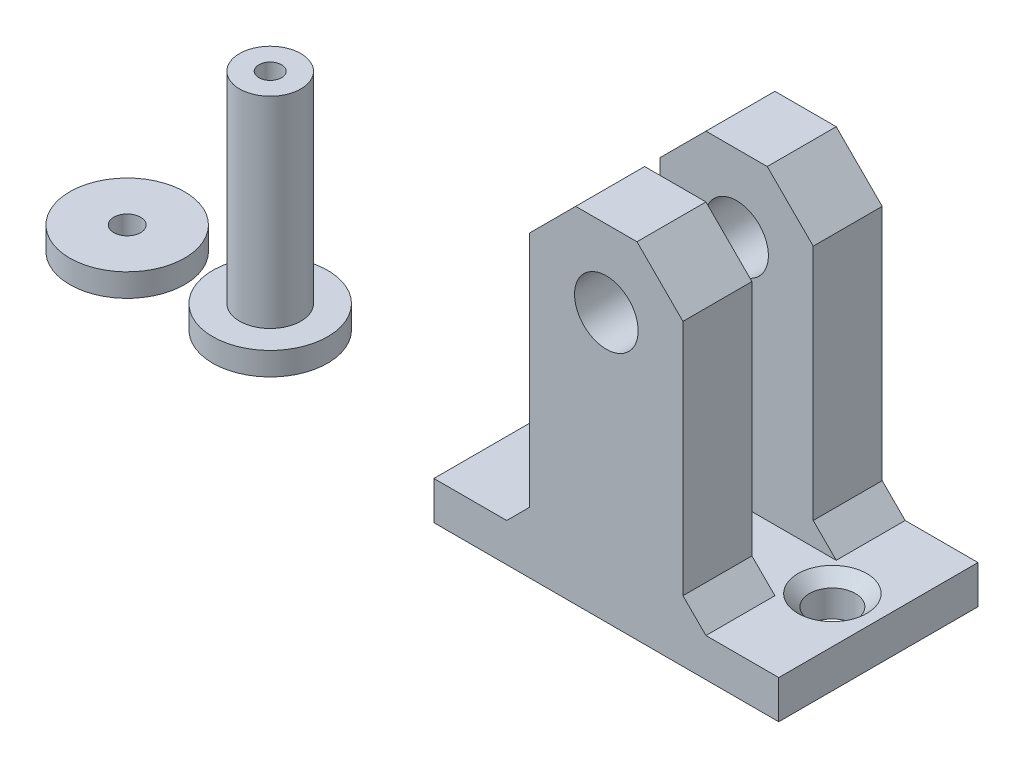
from build123d import *

# Parameters (mm, degrees)
SKETCH1_W           = 45
SKETCH1_H           = 26
SKETCH1_R           = 3
BOSS_EXTRUDE1_DEPTH = 5
SKETCH1_3_W         = 45
SKETCH1_3_H         = 9
BOSS_EXTRUDE2_DEPTH = 45
SKETCH2_R           = 4.15
CUT_EXTRUDE1_DEPTH  = 69.745908969
SKETCH3_W           = 12.5
SKETCH3_H           = 40
CUT_EXTRUDE2_DEPTH  = 69.745908969
CHAMFER1_SIZE       = 6
CHAMFER2_SIZE       = 1.5
CHAMFER3_SIZE       = 3
SKETCH4_R           = 4
SKETCH4_R_2         = 1.475
BOSS_EXTRUDE3_DEPTH = 26.25
SKETCH4_3_R         = 7.5
SKETCH4_3_R_2       = 1.475
SKETCH4_3_R_3       = 1.75
BOSS_EXTRUDE4_DEPTH = 3


with BuildPart() as part:
    # Sketch1 → Boss-Extrude1 (new body)
    with BuildSketch(Plane(origin=(0, 0, 0), x_dir=(1, 0, 0), z_dir=(0, 1, 0))):
        with Locations((22.5, 13)):
            Rectangle(SKETCH1_W, SKETCH1_H)
        with Locations((39, 13)):
            Circle(SKETCH1_R, mode=Mode.SUBTRACT)
        with Locations((6, 13)):
            Circle(SKETCH1_R, mode=Mode.SUBTRACT)
    extrude(amount=BOSS_EXTRUDE1_DEPTH)

    # Sketch1<3> → Boss-Extrude2 (add)
    with BuildSketch(Plane(origin=(0, 0, 0), x_dir=(1, 0, 0), z_dir=(0, 1, 0))):
        with Locations((22.5, 4.5)):
            Rectangle(SKETCH1_3_W, SKETCH1_3_H)
        with Locations((22.5, 21.5)):
            Rectangle(SKETCH1_3_W, SKETCH1_3_H)
    extrude(amount=BOSS_EXTRUDE2_DEPTH)

    # Sketch2 → Cut-Extrude1 (cut, through all)
    with BuildSketch(Plane.XY):
        with Locations((22.5, 35)):
            Circle(SKETCH2_R)
    extrude(amount=-CUT_EXTRUDE1_DEPTH, mode=Mode.SUBTRACT)

    # Sketch3 → Cut-Extrude2 (cut, through all)
    with BuildSketch(Plane.XY):
        with Locations((6.25, 25)):
            Rectangle(SKETCH3_W, SKETCH3_H)
        with Locations((38.75, 25)):
            Rectangle(SKETCH3_W, SKETCH3_H)
    extrude(amount=-CUT_EXTRUDE2_DEPTH, mode=Mode.SUBTRACT)

    # Chamfer1
    chamfer1_edges = [part.edges().sort_by_distance(p)[0] for p in [
        (12.5, 45, -4.5),
        (32.5, 45, -4.5),
        (32.5, 45, -21.5),
        (12.5, 45, -21.5),
    ]]
    chamfer(chamfer1_edges, length=CHAMFER1_SIZE)

    # Chamfer2
    chamfer2_edges = [part.edges().sort_by_distance(p)[0] for p in [
        (3, 5, -13),
        (36, 5, -13),
    ]]
    chamfer(chamfer2_edges, length=CHAMFER2_SIZE)

    # Chamfer3
    chamfer3_edges = [part.edges().sort_by_distance(p)[0] for p in [
        (32.5, 5, -4.5),
        (32.5, 5, -21.5),
        (12.5, 5, -4.5),
        (12.5, 5, -21.5),
    ]]
    chamfer(chamfer3_edges, length=CHAMFER3_SIZE)


with BuildPart() as body_2:
    # Sketch4 → Boss-Extrude3 (new body)
    with BuildSketch(Plane(origin=(0, 0, 0), x_dir=(1, 0, 0), z_dir=(0, 1, 0))):
        with Locations((-35.448910828, 14.088910079)):
            Circle(SKETCH4_R)
        with Locations((-35.448910828, 14.088910079)):
            Circle(SKETCH4_R_2, mode=Mode.SUBTRACT)
    extrude(amount=BOSS_EXTRUDE3_DEPTH)

    # Sketch4<3> → Boss-Extrude4 (add)
    # profile 1 of 2: a face of its own
    with BuildSketch(Plane(origin=(0, 0, 0), x_dir=(1, 0, 0), z_dir=(0, 1, 0))):
        with Locations((-35.448910828, 14.088910079)):
            Circle(SKETCH4_3_R)
        with Locations((-35.448910828, 14.088910079)):
            Circle(SKETCH4_3_R_2, mode=Mode.SUBTRACT)
    # profile 2 of 2: a face of its own
    with BuildSketch(Plane(origin=(0, 0, 0), x_dir=(1, 0, 0), z_dir=(0, 1, 0))):
        with Locations((-53.660477162, 13.641145364)):
            Circle(SKETCH4_3_R)
        with Locations((-53.660477162, 13.641145364)):
            Circle(SKETCH4_3_R_3, mode=Mode.SUBTRACT)
    extrude(amount=-BOSS_EXTRUDE4_DEPTH)


with BuildPart() as boss_extrude4_piece_1:
    # of the separate pieces the step leaves, piece 1, a body of its own (boss_extrude4_pieces)
    add(body_2.part.solids().sort_by_distance((-31.448910828, 0, -14.088910079))[0])


with BuildPart() as boss_extrude4_piece_2:
    # of the separate pieces the step leaves, piece 2, a body of its own (boss_extrude4_pieces)
    add(body_2.part.solids().sort_by_distance((-46.160477162, 0, -13.641145364))[0])


solid = Compound([part.part, boss_extrude4_piece_1.part, boss_extrude4_piece_2.part])
